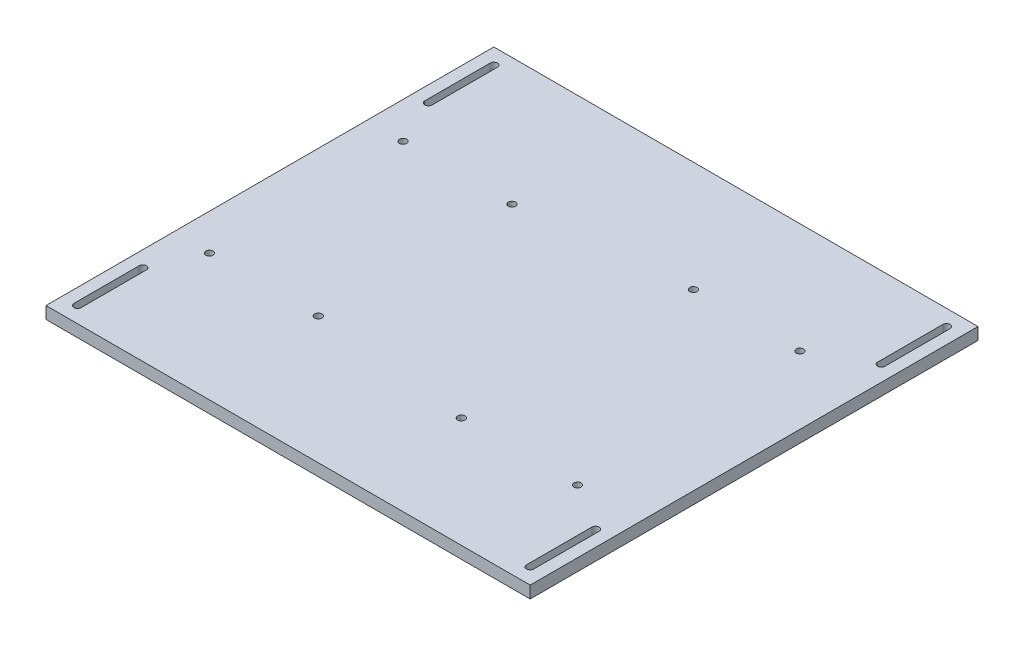
from build123d import *

# Parameters (mm, degrees)
SKETCH2_W           = 200
SKETCH2_H           = 185
BOSS_EXTRUDE1_DEPTH = 5
SKETCH3_R           = 1.5
CUT_EXTRUDE1_DEPTH  = 137.313058802
SKETCH4_R           = 1.5
CUT_EXTRUDE3_DEPTH  = 137.313058802


with BuildPart() as part:
    # Sketch2 → Boss-Extrude1 (new body)
    with BuildSketch(Plane(origin=(0, 0, 0), x_dir=(1, 0, 0), z_dir=(0, 1, 0))):
        Rectangle(SKETCH2_W, SKETCH2_H)
        with BuildLine():
            Line((-95, 59), (-95, 86))
            ThreePointArc((-95, 86), (-93.5, 87.5), (-92, 86))
            Line((-92, 86), (-92, 59))
            ThreePointArc((-92, 59), (-93.5, 57.5), (-95, 59))
        make_face(mode=Mode.SUBTRACT)
        with BuildLine():
            Line((95, 59), (95, 86))
            ThreePointArc((95, 86), (93.5, 87.5), (92, 86))
            Line((92, 86), (92, 59))
            ThreePointArc((92, 59), (93.5, 57.5), (95, 59))
        make_face(mode=Mode.SUBTRACT)
        with BuildLine():
            Line((95, -59), (95, -86))
            ThreePointArc((95, -86), (93.5, -87.5), (92, -86))
            Line((92, -86), (92, -59))
            ThreePointArc((92, -59), (93.5, -57.5), (95, -59))
        make_face(mode=Mode.SUBTRACT)
        with BuildLine():
            Line((-95, -59), (-95, -86))
            ThreePointArc((-95, -86), (-93.5, -87.5), (-92, -86))
            Line((-92, -86), (-92, -59))
            ThreePointArc((-92, -59), (-93.5, -57.5), (-95, -59))
        make_face(mode=Mode.SUBTRACT)
    extrude(amount=BOSS_EXTRUDE1_DEPTH)

    # Sketch3 → Cut-Extrude1 (cut, through all)
    with BuildSketch(Plane(origin=(0, 5, 0), x_dir=(1, 0, 0), z_dir=(0, 1, 0))):
        with Locations((-85, -40)):
            Circle(SKETCH3_R)
        with Locations((-85, 40)):
            Circle(SKETCH3_R)
        with Locations((-40, 40)):
            Circle(SKETCH3_R)
        with Locations((-40, -40)):
            Circle(SKETCH3_R)
    extrude(amount=-CUT_EXTRUDE1_DEPTH, mode=Mode.SUBTRACT)

    # Sketch4 → Cut-Extrude3 (cut, through all)
    with BuildSketch(Plane(origin=(0, 5, 0), x_dir=(1, 0, 0), z_dir=(0, 1, 0))):
        with Locations((28, 46.935)):
            Circle(SKETCH4_R)
        with Locations((72, 46.935)):
            Circle(SKETCH4_R)
        with Locations((26, -46.935)):
            Circle(SKETCH4_R)
        with Locations((74, -46.935)):
            Circle(SKETCH4_R)
    extrude(amount=-CUT_EXTRUDE3_DEPTH, mode=Mode.SUBTRACT)


solid = part.part
